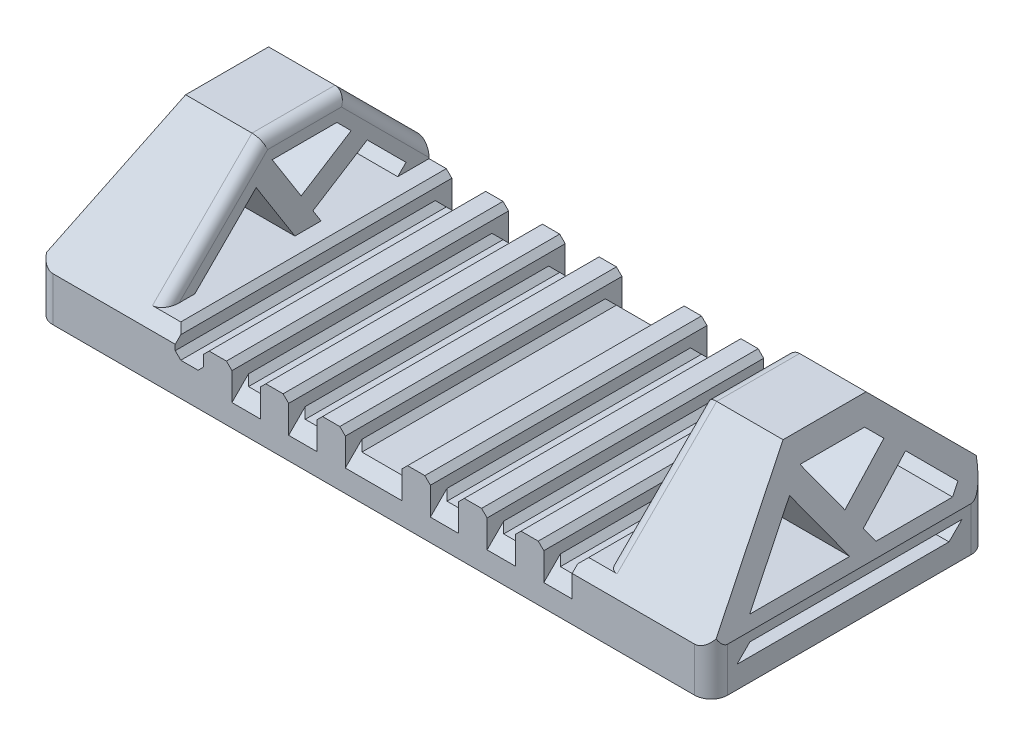
from build123d import *
from OCP.BRepFilletAPI import BRepFilletAPI_MakeChamfer

# Parameters (mm, degrees)
SKETCH1_W                 = 26
SKETCH1_H                 = 18
SKETCH1_W_2               = 134
SKETCH1_H_2               = 10
BOSS_EXTRUDE1_DEPTH       = 50
SKETCH4_W                 = 5.125
SKETCH4_H                 = 50
CUT_EXTRUDE3_DEPTH        = 4
CHAMFER1_SIZE             = 2
CHAMFER2_SIZE             = 1
CHAMFER3_SIZE             = 1
CHAMFER4_SIZE             = 1
CHAMFER5_SIZE             = 15
CHAMFER6_SIZE             = 20
CUT_EXTRUDE4_DEPTH        = 159
CHAMFER9_SIZE             = 3
CHAMFER9_SIZE2            = 2.121320344
SKETCH6_W                 = 42
SKETCH6_H                 = 2.343145751
CUT_EXTRUDE5_DEPTH        = 10
CHAMFER10_SIZE            = 3
CHAMFER10_OF_MIRROR1_SIZE = 3
CUT_EXTRUDE6_DEPTH        = 94
FILLET2_R                 = 2
BOSS_EXTRUDE2_DEPTH       = 1
SKETCH9_W                 = 4
SKETCH9_H                 = 8
CUT_EXTRUDE7_DEPTH        = 84
FILLET3_R                 = 3
FILLET4_R                 = 2


with BuildPart() as part:
    # Sketch1 → Boss-Extrude1 (new body)
    with BuildSketch(Plane.XY):
        with Locations((13, 19)):
            Rectangle(SKETCH1_W, SKETCH1_H)
        with Locations((67, 5)):
            Rectangle(SKETCH1_W_2, SKETCH1_H_2)
        with Locations((121, 19)):
            Rectangle(SKETCH1_W, SKETCH1_H)
    extrude(amount=BOSS_EXTRUDE1_DEPTH)

    # Sketch4 → Cut-Extrude3 (cut)
    with BuildSketch(Plane(origin=(0, 10, 0), x_dir=(1, 0, 0), z_dir=(0, 1, 0))):
        with Locations((33.6875, -25)):
            Rectangle(SKETCH4_W, SKETCH4_H)
        with Locations((100.3125, -25)):
            Rectangle(SKETCH4_W, SKETCH4_H)
        with Locations((43.9375, -25)):
            Rectangle(SKETCH4_W, SKETCH4_H)
        with Locations((90.0625, -25)):
            Rectangle(SKETCH4_W, SKETCH4_H)
        with Locations((54.1875, -25)):
            Rectangle(SKETCH4_W, SKETCH4_H)
        with Locations((79.8125, -25)):
            Rectangle(SKETCH4_W, SKETCH4_H)
        with Locations((64.4375, -25)):
            Rectangle(SKETCH4_W, SKETCH4_H)
        with Locations((69.5625, -25)):
            Rectangle(SKETCH4_W, SKETCH4_H)
    extrude(amount=-CUT_EXTRUDE3_DEPTH, mode=Mode.SUBTRACT)

    # Chamfer1
    chamfer1_edges = [part.edges().sort_by_distance(p)[0] for p in [
        (100.3125, 6, 50),
        (100.3125, 6, 0),
        (43.9375, 6, 0),
        (43.9375, 6, 50),
        (90.0625, 6, 50),
        (90.0625, 6, 0),
        (54.1875, 6, 0),
        (54.1875, 6, 50),
        (33.6875, 6, 0),
        (67, 6, 0),
        (67, 6, 50),
        (79.8125, 6, 50),
        (79.8125, 6, 0),
    ]]
    chamfer(chamfer1_edges, length=CHAMFER1_SIZE)

    # Chamfer2
    chamfer2_edges = [part.edges().sort_by_distance(p)[0] for p in [
        (102.875, 10, 25),
        (97.75, 10, 25),
        (41.375, 10, 25),
        (46.5, 10, 25),
        (92.625, 10, 25),
        (87.5, 10, 25),
        (51.625, 10, 25),
        (56.75, 10, 25),
        (31.125, 10, 25),
        (36.25, 10, 25),
        (61.875, 10, 25),
        (72.125, 10, 25),
        (82.375, 10, 25),
        (77.25, 10, 25),
    ]]
    chamfer(chamfer2_edges, length=CHAMFER2_SIZE)

    # Chamfer3
    chamfer3_edges = [part.edges().sort_by_distance(p)[0] for p in [
        (102.875, 6, 25),
        (97.75, 6, 25),
    ]]
    chamfer(chamfer3_edges, length=CHAMFER3_SIZE)

    # Chamfer4
    chamfer4_edges = [part.edges().sort_by_distance(p)[0] for p in [
        (41.375, 6, 25),
        (46.5, 6, 25),
        (51.625, 6, 25),
        (56.75, 6, 25),
        (61.875, 6, 25),
        (72.125, 6, 25),
        (82.375, 6, 25),
        (77.25, 6, 25),
        (92.625, 6, 25),
        (87.5, 6, 25),
        (36.25, 6, 26),
        (31.125, 6, 26),
    ]]
    chamfer(chamfer4_edges, length=CHAMFER4_SIZE)

    # Chamfer5
    chamfer5_edges = [part.edges().sort_by_distance(p)[0] for p in [
        (121, 28, 0),
        (13, 28, 0),
    ]]
    chamfer(chamfer5_edges, length=CHAMFER5_SIZE)

    # Chamfer6
    chamfer6_edges = [part.edges().sort_by_distance(p)[0] for p in [
        (13, 28, 50),
        (121, 28, 50),
    ]]
    chamfer(chamfer6_edges, length=CHAMFER6_SIZE)

    # Sketch5 → Cut-Extrude4 (cut)
    with BuildSketch(Plane(origin=(134, 0, 0), x_dir=(0, 0, -1), z_dir=(1, 0, 0))):
        Polygon((-23.118005616, 15.713850942), (-14.073840564, 21.416986315), (-16.656854249, 24), (-28.343145751, 24), align=None)
        Polygon((-24.243797472, 10), (-31.243250282, 21.099895469), (-38.343145751, 14), (-42.343145751, 10), align=None)
        Polygon((-20.98443273, 12.330381312), (-19.514923935, 10), (-2.656854249, 10), (-6.656854249, 14), (-11.173736033, 18.516881784), align=None)
    extrude(amount=-CUT_EXTRUDE4_DEPTH, mode=Mode.SUBTRACT)

    # Chamfer9: one chamfer whose edges measure the first distance from different faces: ONE call of the kernel's chamfer builder (chamfer() names one face for all edges)
    chamfer9_edges_1 = [part.edges().sort_by_distance(p)[0] for p in [
        (13, 10, 2.656854249),
    ]]
    chamfer9_side_1 = [part.faces().sort_by_distance(p)[0] for p in [
        (28.0625, 10, 0.566702358),
    ]]
    chamfer9_edges_2 = [part.edges().sort_by_distance(p)[0] for p in [
        (121, 10, 2.656854249),
    ]]
    chamfer9_side_2 = [part.faces().sort_by_distance(p)[0] for p in [
        (104.441702358, 10, 24),
    ]]
    chamfer9 = BRepFilletAPI_MakeChamfer(part.part.solid().wrapped)
    for e in chamfer9_edges_1:
        chamfer9.Add(CHAMFER9_SIZE, CHAMFER9_SIZE2, e.wrapped, chamfer9_side_1[0].wrapped)  # the first distance lies on this face
    for e in chamfer9_edges_2:
        chamfer9.Add(CHAMFER9_SIZE, CHAMFER9_SIZE2, e.wrapped, chamfer9_side_2[0].wrapped)  # the first distance lies on this face
    add(Compound.cast(chamfer9.Shape()), mode=Mode.REPLACE)

    # Sketch6 → Cut-Extrude5 (cut)
    with BuildSketch(Plane(origin=(134, 0, 0), x_dir=(0, 0, -1), z_dir=(1, 0, 0))):
        with Locations((-25, 5.171572876)):
            Rectangle(SKETCH6_W, SKETCH6_H)
    cut_extrude5 = extrude(amount=-CUT_EXTRUDE5_DEPTH, mode=Mode.SUBTRACT)

    # Chamfer10
    # the kernel refuses this chamfer: 3 mm, written as the material it adds along each edge
    with BuildSketch(Plane(origin=(134, 4, 4), x_dir=(0, -0.02749587661058634, 0.9996219169112968), z_dir=(-1, 0, 0)), Plane(origin=(134, 6.343145751, 46), x_dir=(0, 0.02749587661058648, -0.9996219169112968), z_dir=(-1, 0, 0))) as chamfer10_piece_1:
        Polygon((CHAMFER10_SIZE * 0.999621916911, CHAMFER10_SIZE * 0.0274958766106), (-CHAMFER10_SIZE * 0.0274958766106, CHAMFER10_SIZE * 0.999621916911), (0, 0), align=None)
    extrude(amount=17.715048964)

    # Mirror1: Cut-Extrude5 across plane
    add(cut_extrude5.mirror(Plane.ZY.offset(-67)), mode=Mode.SUBTRACT)

    # Chamfer10 of Mirror1
    # the kernel refuses this chamfer: 3 mm, written as the material it adds along each edge
    with BuildSketch(Plane(origin=(0, 4, 4), x_dir=(0, -0.02749587661058634, 0.9996219169112968), z_dir=(1, 0, 0)), Plane(origin=(0, 6.343145751, 46), x_dir=(0, 0.02749587661058648, -0.9996219169112968), z_dir=(1, 0, 0))) as chamfer10_of_mirror1_piece_1:
        Polygon((CHAMFER10_OF_MIRROR1_SIZE * 0.999621916911, -CHAMFER10_OF_MIRROR1_SIZE * 0.0274958766106), (-CHAMFER10_OF_MIRROR1_SIZE * 0.0274958766106, -CHAMFER10_OF_MIRROR1_SIZE * 0.999621916911), (0, 0), align=None)
    extrude(amount=17.715048964)

    # Sketch7 → Cut-Extrude6 (cut)
    with BuildSketch(Plane.XY.offset(50)):
        Polygon((0, 8), (13, 28), (0, 28), align=None)
        Polygon((121, 28), (134, 8), (134, 28), align=None)
    extrude(amount=-CUT_EXTRUDE6_DEPTH, mode=Mode.SUBTRACT)

    # Fillet2
    fillet2_edges = [part.edges().sort_by_distance(p)[0] for p in [
        (0, 4, 0),
        (134, 4, 0),
        (0, 4, 50),
        (134, 4, 50),
    ]]
    fillet(fillet2_edges, radius=FILLET2_R)

    # Sketch8 → Boss-Extrude2 (add)
    with BuildSketch(Plane(origin=(26, 0, 0), x_dir=(0, 0, -1), z_dir=(1, 0, 0))):
        Polygon((-11.173736033, 18.516881784), (-4.156854249, 11.5), (-5.656854249, 10), (0, 10), (0, 13), (-15, 28), (-30, 28), (-48, 10), (-42.343145751, 10), (-31.243250282, 21.099895469), (-24.243797472, 10), (-19.514923935, 10), (-20.98443273, 12.330381312), align=None)
        Polygon((-16.656854249, 24), (-14.073840564, 21.416986315), (-23.118005616, 15.713850942), (-28.343145751, 24), align=None, mode=Mode.SUBTRACT)
    boss_extrude2 = extrude(amount=BOSS_EXTRUDE2_DEPTH)

    # Mirror2: Boss-Extrude2 across plane
    add(boss_extrude2.mirror(Plane(origin=(67, 0, 0), x_dir=(0, 0, 1), z_dir=(1, 0, 0))))

    # Sketch9 → Cut-Extrude7 (cut)
    with BuildSketch(Plane.XY.offset(50)):
        with Locations((4, 4)):
            Rectangle(SKETCH9_W, SKETCH9_H)
        Polygon((0, 8), (0, 0), (2, 0), (2, 8), (6, 8), (6, 17.230769231), align=None)
        Polygon((13, 28), (6, 17.230769231), (6, 8), align=None)
        Polygon((121, 28), (128, 8), (128, 17.230769231), align=None)
        Polygon((132, 8), (132, 0), (134, 0), (134, 8), (128, 17.230769231), (128, 8), align=None)
        with Locations((130, 4)):
            Rectangle(SKETCH9_W, SKETCH9_H)
    extrude(amount=-CUT_EXTRUDE7_DEPTH, mode=Mode.SUBTRACT)

    # Fillet3
    fillet3_edges = [part.edges().sort_by_distance(p)[0] for p in [
        (128, 4, 0),
        (128, 4, 50),
        (6, 4, 50),
        (6, 4, 0),
    ]]
    fillet(fillet3_edges, radius=FILLET3_R)

    # Fillet4
    fillet4_edges = [part.edges().sort_by_distance(p)[0] for p in [
        (27, 20.5, 7.5),
        (27, 28, 22.5),
        (27, 19, 39),
        (107, 19, 39),
        (107, 28, 22.5),
        (107, 20.5, 7.5),
    ]]
    fillet(fillet4_edges, radius=FILLET4_R)


solid = part.part
